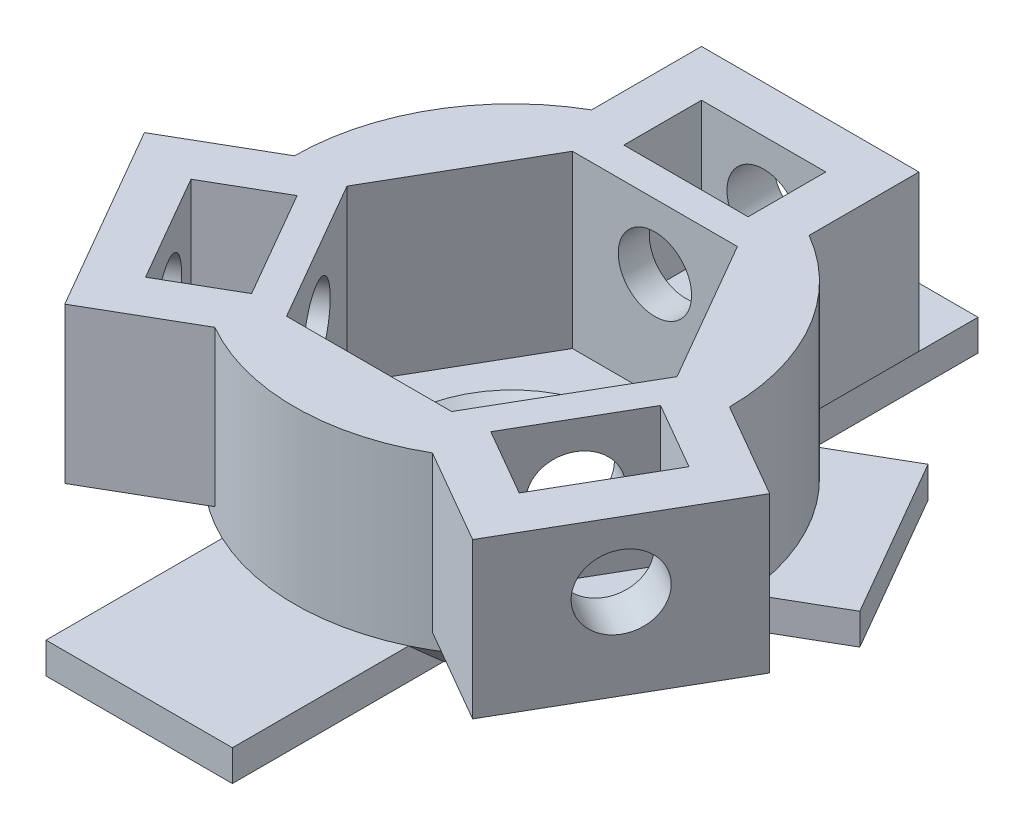
from build123d import *

# Parameters (mm, degrees)
SKETCH1_R           = 3.5
BOSS_EXTRUDE1_DEPTH = 3.25
CUT_EXTRUDE1_DEPTH  = 2.75
SKETCH3_R           = 1.5
CUT_EXTRUDE2_DEPTH  = 6.662375826
BOSS_EXTRUDE6_DEPTH = 0.5
BOSS_EXTRUDE4_START = -2
SKETCH6_W           = 3.5
SKETCH6_H           = 2.5
BOSS_EXTRUDE4_DEPTH = 2.5
SKETCH7_W           = 2
SKETCH7_H           = 1.25
CUT_EXTRUDE3_DEPTH  = 2.23
SKETCH8_R           = 0.59
CUT_EXTRUDE4_DEPTH  = 4
CHAMFER3_SIZE       = 0.5
CIRPATTERN1_COUNT   = 3
CHAMFER4_SIZE       = 0.25


# Some blends are built 0.0001 mm under size
with BuildPart() as part:
    # Sketch1 → Boss-Extrude1 (new body)
    with BuildSketch(Plane(origin=(0, 0, 0), x_dir=(1, 0, 0), z_dir=(0, 1, 0))):
        with Locations(Location((0, 0, 0), (0, 0, 90))):
            Circle(SKETCH1_R)
    extrude(amount=BOSS_EXTRUDE1_DEPTH)

    # Sketch2 → Cut-Extrude1 (cut)
    with BuildSketch(Plane(origin=(0, 3.25, 0), x_dir=(1, 0, 0), z_dir=(0, 1, 0))):
        Polygon((1.327905619, -2.3), (2.655811238, 0), (1.327905619, 2.3), (-1.327905619, 2.3), (-2.655811238, 0), (-1.327905619, -2.3), align=None)
    extrude(amount=-CUT_EXTRUDE1_DEPTH, mode=Mode.SUBTRACT)

    # Sketch3 → Cut-Extrude2 (cut, through all)
    with BuildSketch(Plane(origin=(0, 0.5, 0), x_dir=(1, 0, 0), z_dir=(0, 1, 0))):
        with Locations(Location((0, 0, 0), (0, 0, 270))):
            Circle(SKETCH3_R)
    extrude(amount=-CUT_EXTRUDE2_DEPTH, mode=Mode.SUBTRACT)

    # Sketch4 → Boss-Extrude6 (add)
    with BuildSketch(Plane.XZ):
        with BuildLine():
            Line((-1.5, 4.5), (-1.5, 3.16227766))
            ThreePointArc((-1.5, 3.16227766), (0, 3.5), (1.5, 3.16227766))
            Line((1.5, 3.16227766), (1.5, 4.5))
            Line((1.5, 4.5), (1.5, 6))
            Line((1.5, 6), (-1.5, 6))
            Line((-1.5, 6), (-1.5, 4.5))
        make_face()
        with BuildLine():
            Line((4.647114317, -0.950961894), (3.488612788, -0.282100724))
            ThreePointArc((3.488612788, -0.282100724), (3.031088913, -1.75), (1.988612788, -2.880176936))
            Line((1.988612788, -2.880176936), (3.147114317, -3.549038106))
            Line((3.147114317, -3.549038106), (4.647114317, -0.950961894))
        make_face()
        with BuildLine():
            Line((-3.147114317, -3.549038106), (-1.988612788, -2.880176936))
            ThreePointArc((-1.988612788, -2.880176936), (-3.031088913, -1.75), (-3.488612788, -0.282100724))
            Line((-3.488612788, -0.282100724), (-4.647114317, -0.950961894))
            Line((-4.647114317, -0.950961894), (-3.147114317, -3.549038106))
        make_face()
        with BuildLine():
            Line((1.5, -4.5), (1.5, -3.16227766))
            ThreePointArc((1.5, -3.16227766), (0, -3.5), (-1.5, -3.16227766))
            Line((-1.5, -3.16227766), (-1.5, -4.5))
            Line((-1.5, -4.5), (-1.5, -6))
            Line((-1.5, -6), (1.5, -6))
            Line((1.5, -6), (1.5, -4.5))
        make_face()
    extrude(amount=-BOSS_EXTRUDE6_DEPTH)

    # Sketch6 → Boss-Extrude4 (add)
    with BuildSketch(Plane.XY.offset(-2.8).offset(BOSS_EXTRUDE4_START)):
        with Locations((0, 2)):
            Rectangle(SKETCH6_W, SKETCH6_H)
    boss_extrude4 = extrude(amount=BOSS_EXTRUDE4_DEPTH)

    # Sketch7 → Cut-Extrude3 (cut)
    with BuildSketch(Plane(origin=(0, 3.25, 0), x_dir=(1, 0, 0), z_dir=(0, 1, 0))):
        with Locations((0, 3.425)):
            Rectangle(SKETCH7_W, SKETCH7_H)
    cut_extrude3 = extrude(amount=-CUT_EXTRUDE3_DEPTH, mode=Mode.SUBTRACT)

    # Sketch8 → Cut-Extrude4 (cut)
    with BuildSketch(Plane(origin=(0, 0, -4.8), x_dir=(-1, 0, 0), z_dir=(0, 0, -1))):
        with Locations((0, 2.2)):
            Circle(SKETCH8_R)
    cut_extrude4 = extrude(amount=-CUT_EXTRUDE4_DEPTH, mode=Mode.SUBTRACT)

    # Chamfer3
    # the kernel refuses this chamfer: 0.5 mm, written as the material it takes off along each edge
    with BuildSketch(Plane(origin=(0, 0, 0), x_dir=(-0.90124662040542, 0, -0.4333065072299383), z_dir=(0.4333065072299383, 0, -0.90124662040542))) as chamfer3_piece_1_section:
        Polygon((3.5, CHAMFER3_SIZE), (3.5 - CHAMFER3_SIZE, 0), (3.5, 0), align=None)
    chamfer3_piece_1 = revolve(axis=Axis((0, 0, 0), (0, 1, 0)), revolution_arc=111.355166333, mode=Mode.PRIVATE)
    chamfer3_piece_1 = split(chamfer3_piece_1, bisect_by=Plane(origin=(-2.813419939, 0.5, 1.624328759), z_dir=(0, -1, 0)), keep=Keep.TOP, mode=Mode.PRIVATE)
    chamfer3_piece_1 = split(chamfer3_piece_1, bisect_by=Plane(origin=(-2.15670997, 0.237200346, 0.486873726), z_dir=(-0.5000000000000004, 0, 0.8660254037844385)), keep=Keep.TOP, mode=Mode.PRIVATE)
    chamfer3_piece_1 = split(chamfer3_piece_1, bisect_by=Plane(origin=(-1.5, 0.237200346, 1.624328759), z_dir=(-1, 0, 0)), keep=Keep.TOP, mode=Mode.PRIVATE)
    add(chamfer3_piece_1, mode=Mode.SUBTRACT)
    with BuildSketch(Plane(origin=(0, 0, 0), x_dir=(0.8258293731996098, 0, -0.5639200708972323), z_dir=(0.5639200708972323, 0, 0.8258293731996098))) as chamfer3_piece_2_section:
        Polygon((3.5, CHAMFER3_SIZE), (3.5 - CHAMFER3_SIZE, 0), (3.5, 0), align=None)
    chamfer3_piece_2 = revolve(axis=Axis((0, 0, 0), (0, 1, 0)), revolution_arc=51.345334665, mode=Mode.PRIVATE)
    chamfer3_piece_2 = split(chamfer3_piece_2, bisect_by=Plane(origin=(1.689638758, 0.5, -2.926540175), z_dir=(0, -1, 0)), keep=Keep.TOP, mode=Mode.PRIVATE)
    chamfer3_piece_2 = split(chamfer3_piece_2, bisect_by=Plane(origin=(1.784458137, 0.189171232, -2.762308193), z_dir=(-0.5000000000000001, 0, -0.8660254037844386)), keep=Keep.TOP, mode=Mode.PRIVATE)
    chamfer3_piece_2 = split(chamfer3_piece_2, bisect_by=Plane(origin=(1.5, 0.189171232, -2.926540175), z_dir=(1, 0, 0)), keep=Keep.TOP, mode=Mode.PRIVATE)
    add(chamfer3_piece_2, mode=Mode.SUBTRACT)
    with BuildSketch(Plane(origin=(0, 0, 0), x_dir=(0.0753688673164782, 0, 0.9971557219609338), z_dir=(-0.9971557219609338, 0, 0.0753688673164782))) as chamfer3_piece_3_section:
        Polygon((3.5, CHAMFER3_SIZE), (3.5 - CHAMFER3_SIZE, 0), (3.5, 0), align=None)
    chamfer3_piece_3 = revolve(axis=Axis((0, 0, 0), (0, 1, 0)), revolution_arc=111.355166333, mode=Mode.PRIVATE)
    chamfer3_piece_3 = split(chamfer3_piece_3, bisect_by=Plane(origin=(2.813419939, 0.5, 1.624328759), z_dir=(0, -1, 0)), keep=Keep.TOP, mode=Mode.PRIVATE)
    chamfer3_piece_3 = split(chamfer3_piece_3, bisect_by=Plane(origin=(1.5, 0.237200346, 1.624328759), z_dir=(1, 0, 0)), keep=Keep.TOP, mode=Mode.PRIVATE)
    chamfer3_piece_3 = split(chamfer3_piece_3, bisect_by=Plane(origin=(2.15670997, 0.237200346, 0.486873726), z_dir=(0.4999999999999997, 0, 0.8660254037844388)), keep=Keep.TOP, mode=Mode.PRIVATE)
    add(chamfer3_piece_3, mode=Mode.SUBTRACT)

    # CirPattern1: Boss-Extrude4, Cut-Extrude3, Cut-Extrude4 ×3 about axis
    cirpattern1_axis = Axis((0, 0, 0), (0, 1, 0))
    add([boss_extrude4.rotate(cirpattern1_axis, i * 360 / CIRPATTERN1_COUNT) for i in range(1, CIRPATTERN1_COUNT)])
    add([cut_extrude3.rotate(cirpattern1_axis, i * 360 / CIRPATTERN1_COUNT) for i in range(1, CIRPATTERN1_COUNT)], mode=Mode.SUBTRACT)
    add([cut_extrude4.rotate(cirpattern1_axis, i * 360 / CIRPATTERN1_COUNT) for i in range(1, CIRPATTERN1_COUNT)], mode=Mode.SUBTRACT)

    # Chamfer4
    chamfer4_edges = [part.edges().sort_by_distance(p)[0] for p in [
        (0, 0, -1.5),
        (0, 0.5, -1.5),
    ]]
    chamfer(chamfer4_edges, length=CHAMFER4_SIZE - 0.0001)  # a hair under: the kernel refuses the full size


solid = part.part
